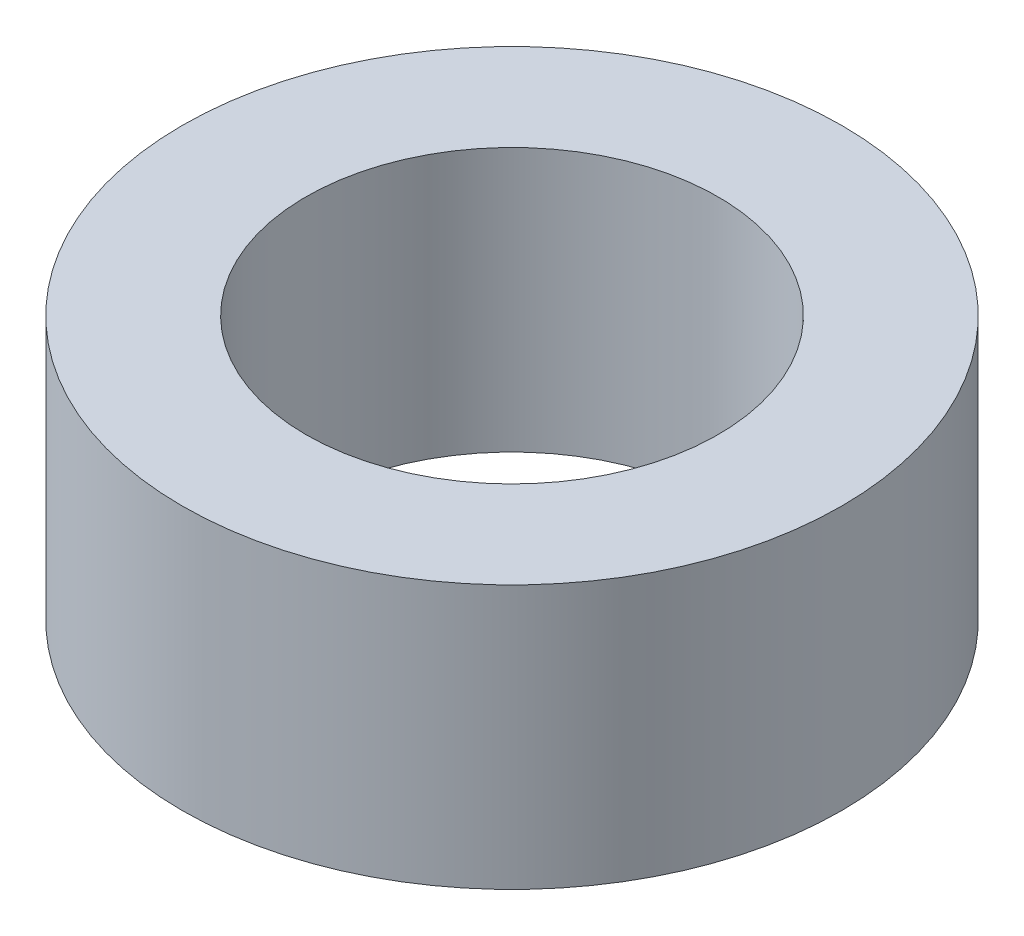
from build123d import *

# Parameters (mm, degrees)
SKETCH1_R           = 20
BOSS_EXTRUDE1_DEPTH = 16
SKETCH2_R           = 12.5
CUT_EXTRUDE1_DEPTH  = 33.496153619


with BuildPart() as part:
    # Sketch1 → Boss-Extrude1 (new body)
    with BuildSketch(Plane(origin=(0, 0, 0), x_dir=(1, 0, 0), z_dir=(0, 1, 0))):
        Circle(SKETCH1_R)
    extrude(amount=BOSS_EXTRUDE1_DEPTH)

    # Sketch2 → Cut-Extrude1 (cut, through all)
    with BuildSketch(Plane(origin=(0, 0, 0), x_dir=(1, 0, 0), z_dir=(0, 1, 0))):
        Circle(SKETCH2_R)
    extrude(amount=CUT_EXTRUDE1_DEPTH, mode=Mode.SUBTRACT)


solid = part.part
